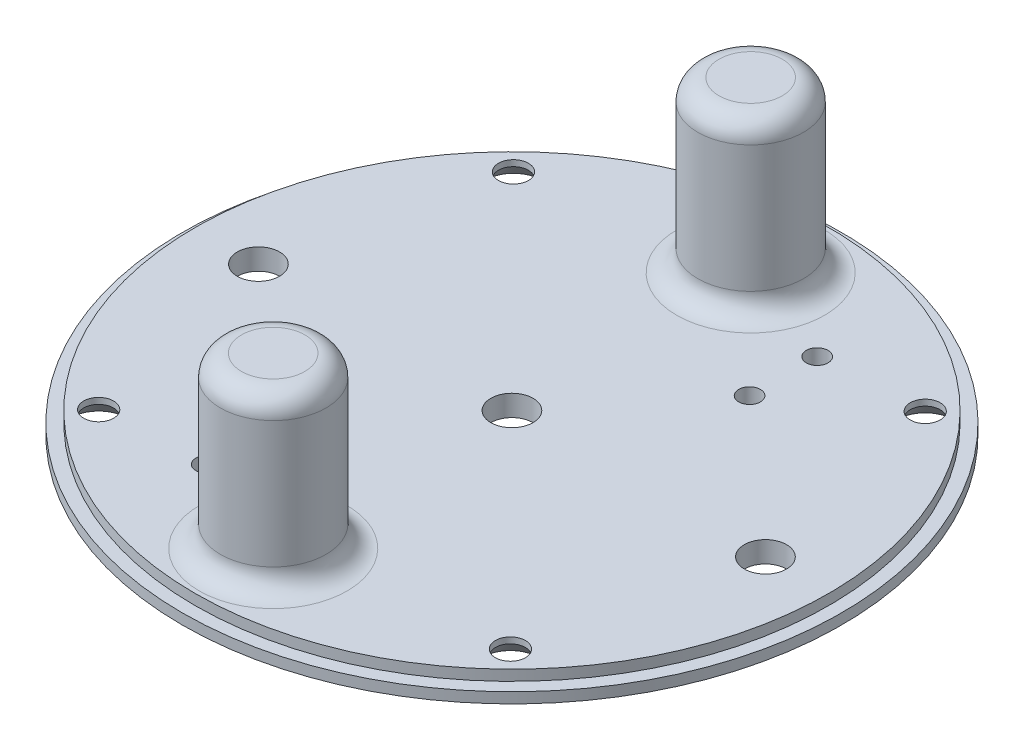
from build123d import *

# Parameters (mm, degrees)
SKETCH1_R             = 49.53
BOSS_EXTRUDE1_DEPTH   = 1.5875
SKETCH2_R             = 47.625
BOSS_EXTRUDE2_DEPTH   = 1.5875
SKETCH3_R             = 3.175
CUT_EXTRUDE1_DEPTH    = 71.117918002
SKETCH5_R             = 3.175
CUT_EXTRUDE2_DEPTH    = 71.117918002
CIRPATTERN1_COUNT     = 4
F_4_CLEARANCE_HOLE1_D = 3.2639
SKETCH14_R            = 7.9375
BOSS_EXTRUDE3_DEPTH   = 25.4
SKETCH15_R            = 6.35
CUT_EXTRUDE3_DEPTH    = 26.9875
FILLET1_R             = 3.175


with BuildPart() as part:
    # Sketch1 → Boss-Extrude1 (new body)
    with BuildSketch(Plane(origin=(0, 0, 0), x_dir=(1, 0, 0), z_dir=(0, 1, 0))):
        Circle(SKETCH1_R)
    extrude(amount=BOSS_EXTRUDE1_DEPTH)

    # Sketch2 → Boss-Extrude2 (add)
    with BuildSketch(Plane(origin=(0, 1.5875, 0), x_dir=(1, 0, 0), z_dir=(0, 1, 0))):
        Circle(SKETCH2_R)
    extrude(amount=BOSS_EXTRUDE2_DEPTH)

    # Sketch3 → Cut-Extrude1 (cut, through all)
    with BuildSketch(Plane(origin=(0, 3.175, 0), x_dir=(1, 0, 0), z_dir=(0, 1, 0))):
        with Locations((-38.1, 0)):
            Circle(SKETCH3_R)
        with Locations((38.1, 0)):
            Circle(SKETCH3_R)
    extrude(amount=-CUT_EXTRUDE1_DEPTH, mode=Mode.SUBTRACT)

    # Sketch5 → Cut-Extrude2 (cut, through all)
    with BuildSketch(Plane(origin=(0, 3.175, 0), x_dir=(1, 0, 0), z_dir=(0, 1, 0))):
        Circle(SKETCH5_R)
    extrude(amount=-CUT_EXTRUDE2_DEPTH, mode=Mode.SUBTRACT)

    # Sketch8 → CSK for #8 Flat Head Machine Screw2 (revolve, cut)
    with BuildSketch(Plane(origin=(-31.169774814, 0, 30.940594366), x_dir=(0, 0, -1), z_dir=(1, 0, 0))):
        Polygon((0, 0), (0, 3.175), (2.2479, 3.175), (2.2479, 2.26450021), (4.2164, 0), align=None)
    csk_for_8_flat_head_machine_screw2 = revolve(axis=Axis((-31.169774814, -6.35, 30.940594366), (0, 1, 0)), mode=Mode.SUBTRACT)

    # CirPattern1: CSK for #8 Flat Head Machine Screw2 ×4 about axis
    cirpattern1_axis = Axis((0, 0, 0), (0, 1, 0))
    for i in range(1, CIRPATTERN1_COUNT):
        add(csk_for_8_flat_head_machine_screw2.rotate(cirpattern1_axis, i * 360 / CIRPATTERN1_COUNT), mode=Mode.SUBTRACT)

    # #4 Clearance Hole1 (through all)
    with Locations(Plane(origin=(0, 0, 0), x_dir=(-1, 0, 0), z_dir=(0, -1, 0))):
        with Locations((-15.929774814, 19.783889264), (15.929774814, -19.783889264), (-15.929774814, 29.943889264), (15.929774814, -29.943889264)):
            Hole(F_4_CLEARANCE_HOLE1_D / 2)

    # Sketch14 → Boss-Extrude3 (add)
    with BuildSketch(Plane(origin=(0, 3.175, 0), x_dir=(1, 0, 0), z_dir=(0, 1, 0))):
        with Locations((0, 35.8775)):
            Circle(SKETCH14_R)
        with Locations((0, -35.8775)):
            Circle(SKETCH14_R)
    extrude(amount=BOSS_EXTRUDE3_DEPTH)

    # Sketch15 → Cut-Extrude3 (cut)
    with BuildSketch(Plane.XZ):
        with Locations((0, -35.8775)):
            Circle(SKETCH15_R)
        with Locations((0, 35.8775)):
            Circle(SKETCH15_R)
    extrude(amount=-CUT_EXTRUDE3_DEPTH, mode=Mode.SUBTRACT)

    # Fillet1
    fillet1_edges = [part.edges().sort_by_distance(p)[0] for p in [
        (-7.9375, 3.175, -35.8775),
        (-7.9375, 3.175, 35.8775),
        (-7.9375, 28.575, -35.8775),
        (-7.9375, 28.575, 35.8775),
        (-6.35, 26.9875, 35.8775),
        (-6.35, 26.9875, -35.8775),
    ]]
    fillet(fillet1_edges, radius=FILLET1_R)


solid = part.part
